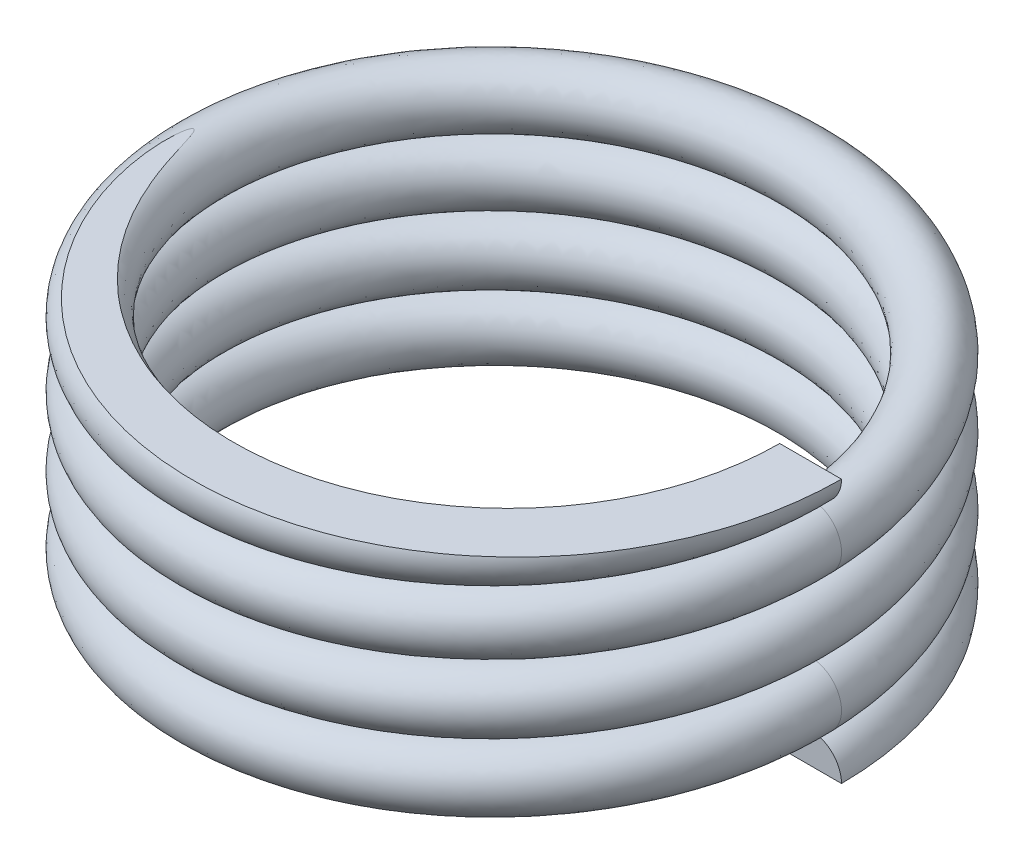
from build123d import *

# Parameters (mm, degrees)
SKETCH4_R           = 0.5715
EXTRUDE1_DEPTH      = 11.198285919
EXTRUDE1_DEPTH_BACK = 11.198285919
SKETCH6_W           = 12.192
SKETCH6_H           = 12.192


with BuildPart() as part:
    # Sweep1: sweep along a curve in space
    with BuildLine() as sweep1_path:
        add(Edge.make_bspline(
            [(6.096, 0, 0), (6.096, 0.024185706, -0.792851842), (5.778592689, 0.073097382, -2.395894437), (4.422743369, 0.146030605, -4.42212093), (2.393571463, 0.219080197, -5.778759471), (0, 0.292098608, -6.254658967), (-2.393571463, 0.365125373, -5.778604659), (-4.422743369, 0.438149901, -4.422740177), (-5.778592689, 0.511175025, -2.393572261), (-6.254703655, 0.5842, 0), (-5.778592689, 0.657224975, 2.393572261), (-4.422743369, 0.730250099, 4.422740177), (-2.393571463, 0.803274627, 5.778604659), (0, 0.876301392, 6.254658967), (2.393571463, 0.949319803, 5.778759471), (4.422743369, 1.022369395, 4.42212093), (5.778592689, 1.095302618, 2.395894437), (6.096, 1.144214294, 0.792851842), (6.096, 1.1684, 0)],
            knots=[0, 0, 0, 0, 0.0625, 0.125, 0.1875, 0.25, 0.3125, 0.375, 0.4375, 0.5, 0.5625, 0.625, 0.6875, 0.75, 0.8125, 0.875, 0.9375, 1, 1, 1, 1], degree=3))
        add(Edge.make_bspline(
            [(6.096, 1.1684, 0), (6.096, 1.194688839, -0.792852707), (5.778592689, 1.247853663, -2.395894036), (4.422743369, 1.327128922, -4.422121038), (2.393571463, 1.406530648, -5.778759442), (0, 1.485898487, -6.254658974), (-2.393571463, 1.565275405, -5.778604662), (-4.422743369, 1.644649891, -4.422740161), (-5.778592689, 1.724025029, -2.393572323), (-6.254703655, 1.803399992, 2.3e-07), (-5.778592689, 1.882775002, 2.393571402), (-4.422743369, 1.962149999, 4.422743386), (-2.393571463, 2.041525, 5.778592685), (0, 2.1209, 6.254703657), (2.393571463, 2.200275, 5.778592689), (4.422743369, 2.27965, 4.422743369), (5.778592689, 2.359025, 2.393571463), (6.254703655, 2.4384, 0), (5.778592689, 2.517775, -2.393571463), (4.422743369, 2.59715, -4.422743369), (2.393571463, 2.676525, -5.778592689), (0, 2.7559, -6.254703657), (-2.393571463, 2.835275, -5.778592685), (-4.422743369, 2.914650001, -4.422743386), (-5.778592689, 2.994024998, -2.393571402), (-6.254703655, 3.073400008, -2.3e-07), (-5.778592689, 3.152774971, 2.393572323), (-4.422743369, 3.232150109, 4.422740161), (-2.393571463, 3.311524595, 5.778604662), (0, 3.390901513, 6.254658974), (2.393571463, 3.470269352, 5.778759442), (4.422743369, 3.549671078, 4.422121038), (5.778592689, 3.628946337, 2.395894036), (6.096, 3.682111161, 0.792852707), (6.096, 3.7084, 0)],
            knots=[0, 0, 0, 0, 0.03125, 0.0625, 0.09375, 0.125, 0.15625, 0.1875, 0.21875, 0.25, 0.28125, 0.3125, 0.34375, 0.375, 0.40625, 0.4375, 0.46875, 0.5, 0.53125, 0.5625, 0.59375, 0.625, 0.65625, 0.6875, 0.71875, 0.75, 0.78125, 0.8125, 0.84375, 0.875, 0.90625, 0.9375, 0.96875, 1, 1, 1, 1], degree=3))
        add(Edge.make_bspline(
            [(6.096, 3.7084, 0), (6.096, 3.732585706, -0.792851842), (5.778592689, 3.781497382, -2.395894437), (4.422743369, 3.854430605, -4.42212093), (2.393571463, 3.927480197, -5.778759471), (0, 4.000498608, -6.254658967), (-2.393571463, 4.073525373, -5.778604659), (-4.422743369, 4.146549901, -4.422740177), (-5.778592689, 4.219575025, -2.393572261), (-6.254703655, 4.2926, 0), (-5.778592689, 4.365624975, 2.393572261), (-4.422743369, 4.438650099, 4.422740177), (-2.393571463, 4.511674627, 5.778604659), (0, 4.584701392, 6.254658967), (2.393571463, 4.657719803, 5.778759471), (4.422743369, 4.730769395, 4.42212093), (5.778592689, 4.803702618, 2.395894437), (6.096, 4.852614294, 0.792851842), (6.096, 4.8768, 0)],
            knots=[0, 0, 0, 0, 0.0625, 0.125, 0.1875, 0.25, 0.3125, 0.375, 0.4375, 0.5, 0.5625, 0.625, 0.6875, 0.75, 0.8125, 0.875, 0.9375, 1, 1, 1, 1], degree=3))
    # Sketch4 → Sweep1 (sweep)
    with BuildSketch(Plane.XY):
        with Locations((5.5245, 0)):
            Circle(SKETCH4_R)
    sweep(path=sweep1_path.line, is_frenet=True, transition=Transition.RIGHT)

    # Sketch6 → Extrude1 (cut, two sides: drawn at the far end of the back side and taken through both)
    with BuildSketch(Plane.XY.offset(-EXTRUDE1_DEPTH_BACK)):
        with Locations((0, 10.9728)):
            Rectangle(SKETCH6_W, SKETCH6_H)
        with Locations((0, -6.096)):
            Rectangle(SKETCH6_W, SKETCH6_H)
    extrude(amount=EXTRUDE1_DEPTH + EXTRUDE1_DEPTH_BACK, mode=Mode.SUBTRACT)


solid = part.part
